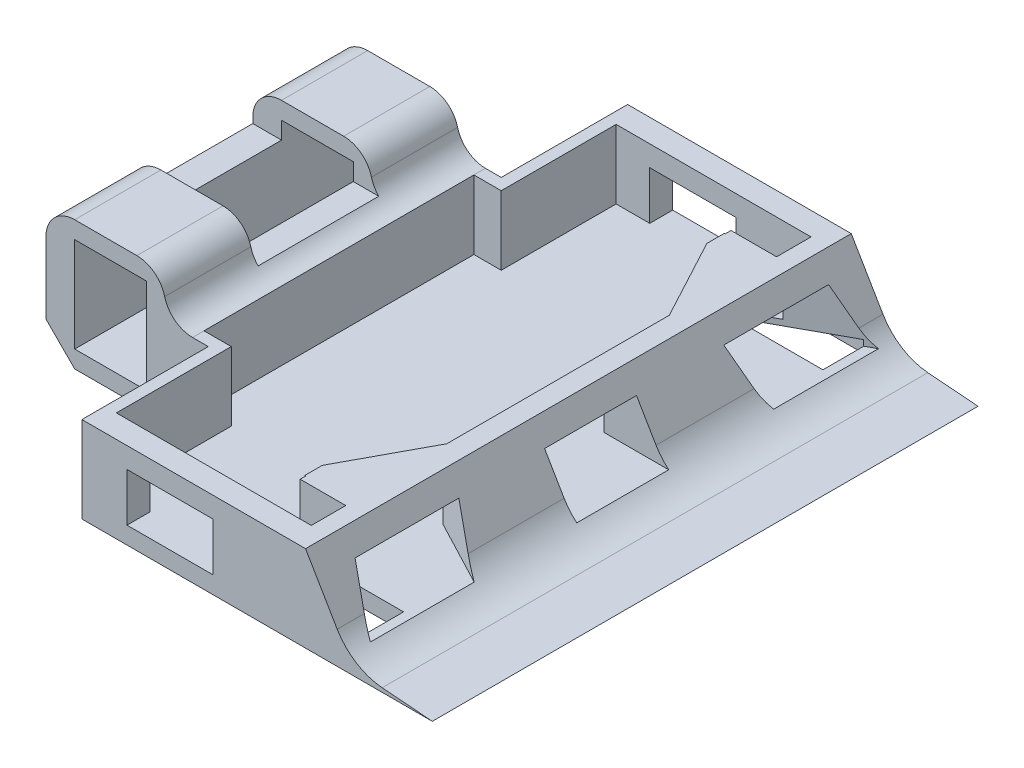
from build123d import *

# Parameters (mm, degrees)
SKETCH1_W                = 95
SKETCH1_H                = 95
BOSS_EXTRUDE1_DEPTH      = 20
SKETCH2_W                = 15
SKETCH2_H                = 8.4
CUT_EXTRUDE1_DEPTH       = 50
CUT_EXTRUDE3_DEPTH       = 100
FILLET1_R                = 10
CUT_EXTRUDE4_DEPTH       = 17
SKETCH8_W                = 15
SKETCH8_H                = 8.4
CUT_EXTRUDE5_DEPTH       = 4
SKETCH9_W                = 15
SKETCH9_H                = 8.4
CUT_EXTRUDE6_DEPTH       = 4
SKETCH10_W               = 15
SKETCH10_H               = 8.4
CUT_EXTRUDE7_DEPTH       = 100
SKETCH11_W               = 15
SKETCH11_H               = 8.4
CUT_EXTRUDE8_DEPTH       = 100
SKETCH12_W               = 96.22761595
SKETCH12_H               = 5
CUT_EXTRUDE9_DEPTH       = 100
SKETCH14_W               = 16
SKETCH14_H               = 8.4
CUT_EXTRUDE10_DEPTH      = 100
SKETCH15_W               = 16
SKETCH15_H               = 8.4
CUT_EXTRUDE11_DEPTH      = 100
SKETCH16_W               = 16
SKETCH16_H               = 8.4
CUT_EXTRUDE13_DEPTH      = 100
CUT_EXTRUDE16_DEPTH      = 12
SKETCH21_W               = 23.779532914
SKETCH21_H               = 2
BOSS_EXTRUDE2_DEPTH      = 12
SKETCH23_W               = 23.759878039
SKETCH23_H               = 2
BOSS_EXTRUDE3_DEPTH      = 12
CUT_EXTRUDE19_DEPTH      = 100
CUT_EXTRUDE19_DEPTH_BACK = 100
SKETCH24_W               = 15
SKETCH24_H               = 8.4
SKETCH26_W               = 20
SKETCH26_H               = 95
BOSS_EXTRUDE4_DEPTH      = 20
SKETCH31_W               = 95
SKETCH31_H               = 20
BOSS_EXTRUDE6_DEPTH      = 10
SKETCH32_W               = 12.5
SKETCH32_H               = 16.5
CUT_EXTRUDE22_DEPTH      = 100
SKETCH33_W               = 3.75
SKETCH33_H               = 20
CUT_EXTRUDE23_DEPTH      = 100
SKETCH34_W               = 26.25
SKETCH34_H               = 12.5
CUT_EXTRUDE24_DEPTH      = 100
SKETCH35_W               = 34
SKETCH35_H               = 47.07285681
CUT_EXTRUDE25_DEPTH      = 22
SKETCH36_W               = 34
SKETCH36_H               = 30.604426896
CUT_EXTRUDE26_DEPTH      = 22
SKETCH37_W               = 26.25
SKETCH37_H               = 21
CUT_EXTRUDE28_DEPTH      = 6
SKETCH38_W               = 5.75
SKETCH38_H               = 22.5
CUT_EXTRUDE29_DEPTH      = 100
CHAMFER1_SIZE            = 5
SKETCH39_W               = 2.070576792
SKETCH39_H               = 87
CUT_EXTRUDE30_DEPTH      = 12
FILLET4_R                = 5
FILLET5_R                = 5
SKETCH40_W               = 4.75
SKETCH40_H               = 47
CUT_EXTRUDE31_DEPTH      = 12
FILLET6_R                = 5
SKETCH46_W               = 17
SKETCH46_H               = 9
CUT_EXTRUDE36_DEPTH      = 4
SKETCH47_R               = 1.25
CUT_EXTRUDE37_DEPTH      = 100
SKETCH48_W               = 6
SKETCH48_H               = 6
CUT_EXTRUDE40_DEPTH      = 10
SKETCH49_W               = 2.104185464
SKETCH49_H               = 6
SKETCH49_W_2             = 2.084530589
CUT_EXTRUDE41_DEPTH      = 20
SKETCH50_W               = 3
SKETCH50_H               = 9
CUT_EXTRUDE42_DEPTH      = 20
SKETCH51_W               = 3
SKETCH51_H               = 15
BOSS_EXTRUDE7_DEPTH      = 2
SKETCH52_W               = 3
SKETCH52_H               = 15
BOSS_EXTRUDE8_DEPTH      = 2


with BuildPart() as part:
    # Sketch1 → Boss-Extrude1 (new body)
    with BuildSketch(Plane(origin=(0, 0, 0), x_dir=(1, 0, 0), z_dir=(0, 1, 0))):
        with Locations((-2.165031067, 2.677660124)):
            Rectangle(SKETCH1_W, SKETCH1_H)
    extrude(amount=BOSS_EXTRUDE1_DEPTH)

    # Sketch2 → Cut-Extrude1 (cut)
    with BuildSketch(Plane(origin=(45.334968933, 0, 0), x_dir=(0, 0, -1), z_dir=(1, 0, 0))):
        with Locations((2.677660124, 7.2)):
            Rectangle(SKETCH2_W, SKETCH2_H)
    extrude(amount=-CUT_EXTRUDE1_DEPTH, mode=Mode.SUBTRACT)

    # Sketch6 → Cut-Extrude3 (cut)
    with BuildSketch(Plane.XY.offset(44.822339876)):
        Polygon((45.334968933, 0), (31.416327077, 1.119733542), (20.334968933, 20), (45.334968933, 20), align=None)
    extrude(amount=-CUT_EXTRUDE3_DEPTH, mode=Mode.SUBTRACT)

    # Fillet1
    # the kernel refuses this fillet: 10 mm, written as the material it adds along each edge
    with BuildSketch(Plane(origin=(31.416327077, 1.119733542, 44.822339876), x_dir=(0.9967796443594351, -0.08018940447888392, 0), z_dir=(0, 0, -1))) as fillet1_piece_1_section:
        with BuildLine():
            CenterArc((FILLET1_R * 0.52046366993, -FILLET1_R), FILLET1_R, 90, 54.990678882)
            Line((-FILLET1_R * 0.298595051697, -FILLET1_R * 0.426290308146), (0, 0))
            Line((0, 0), (FILLET1_R * 0.52046366993, 0))
        make_face()
    fillet1_piece_1 = extrude(amount=95, mode=Mode.PRIVATE)
    fillet1_piece_1 = split(fillet1_piece_1, bisect_by=Plane(origin=(32.462514907, 1.548685907, 4.822339876), z_dir=(0, 0, 1)), keep=Keep.TOP, mode=Mode.PRIVATE)
    fillet1_piece_1 = split(fillet1_piece_1, bisect_by=Plane(origin=(32.462514907, 3, 24.822339876), z_dir=(0, -1, 0)), keep=Keep.TOP, mode=Mode.PRIVATE)
    add(fillet1_piece_1)
    with BuildSketch(Plane(origin=(31.416327077, 1.119733542, 44.822339876), x_dir=(0.9967796443594351, -0.08018940447888392, 0), z_dir=(0, 0, -1))) as fillet1_piece_2_section:
        with BuildLine():
            CenterArc((FILLET1_R * 0.52046366993, -FILLET1_R), FILLET1_R, 90, 54.990678882)
            Line((-FILLET1_R * 0.298595051697, -FILLET1_R * 0.426290308146), (0, 0))
            Line((0, 0), (FILLET1_R * 0.52046366993, 0))
        make_face()
    fillet1_piece_2 = extrude(amount=95, mode=Mode.PRIVATE)
    fillet1_piece_2 = split(fillet1_piece_2, bisect_by=Plane(origin=(29.780943428, 3.965739863, 4.822339876), z_dir=(0, 0, 1)), keep=Keep.TOP, mode=Mode.PRIVATE)
    fillet1_piece_2 = split(fillet1_piece_2, bisect_by=Plane(origin=(29.780943428, 3, 24.822339876), z_dir=(0, 1, 0)), keep=Keep.TOP, mode=Mode.PRIVATE)
    add(fillet1_piece_2)
    with BuildSketch(Plane(origin=(31.416327077, 1.119733542, 44.822339876), x_dir=(0.9967796443594351, -0.08018940447888392, 0), z_dir=(0, 0, -1))) as fillet1_piece_3_section:
        with BuildLine():
            CenterArc((FILLET1_R * 0.52046366993, -FILLET1_R), FILLET1_R, 90, 54.990678882)
            Line((-FILLET1_R * 0.298595051697, -FILLET1_R * 0.426290308146), (0, 0))
            Line((0, 0), (FILLET1_R * 0.52046366993, 0))
        make_face()
    fillet1_piece_3 = extrude(amount=95, mode=Mode.PRIVATE)
    fillet1_piece_3 = split(fillet1_piece_3, bisect_by=Plane(origin=(32.462514907, 1.548685907, -10.177660124), z_dir=(0, 0, 1)), keep=Keep.TOP, mode=Mode.PRIVATE)
    fillet1_piece_3 = split(fillet1_piece_3, bisect_by=Plane(origin=(32.462514907, 1.548685907, 4.822339876), z_dir=(0, 0, -1)), keep=Keep.TOP, mode=Mode.PRIVATE)
    fillet1_piece_3 = split(fillet1_piece_3, bisect_by=Plane(origin=(32.462514907, 3, -2.677660124), z_dir=(0, -1, 0)), keep=Keep.TOP, mode=Mode.PRIVATE)
    add(fillet1_piece_3)
    with BuildSketch(Plane(origin=(31.416327077, 1.119733542, 44.822339876), x_dir=(0.9967796443594351, -0.08018940447888392, 0), z_dir=(0, 0, -1))) as fillet1_piece_4_section:
        with BuildLine():
            CenterArc((FILLET1_R * 0.52046366993, -FILLET1_R), FILLET1_R, 90, 54.990678882)
            Line((-FILLET1_R * 0.298595051697, -FILLET1_R * 0.426290308146), (0, 0))
            Line((0, 0), (FILLET1_R * 0.52046366993, 0))
        make_face()
    fillet1_piece_4 = extrude(amount=95, mode=Mode.PRIVATE)
    fillet1_piece_4 = split(fillet1_piece_4, bisect_by=Plane(origin=(32.462514907, 1.548685907, -10.177660124), z_dir=(0, 0, -1)), keep=Keep.TOP, mode=Mode.PRIVATE)
    fillet1_piece_4 = split(fillet1_piece_4, bisect_by=Plane(origin=(32.462514907, 3, -30.177660124), z_dir=(0, -1, 0)), keep=Keep.TOP, mode=Mode.PRIVATE)
    add(fillet1_piece_4)
    with BuildSketch(Plane(origin=(31.416327077, 1.119733542, 44.822339876), x_dir=(0.9967796443594351, -0.08018940447888392, 0), z_dir=(0, 0, -1))) as fillet1_piece_5_section:
        with BuildLine():
            CenterArc((FILLET1_R * 0.52046366993, -FILLET1_R), FILLET1_R, 90, 54.990678882)
            Line((-FILLET1_R * 0.298595051697, -FILLET1_R * 0.426290308146), (0, 0))
            Line((0, 0), (FILLET1_R * 0.52046366993, 0))
        make_face()
    fillet1_piece_5 = extrude(amount=95, mode=Mode.PRIVATE)
    fillet1_piece_5 = split(fillet1_piece_5, bisect_by=Plane(origin=(29.780943428, 3.965739863, -10.177660124), z_dir=(0, 0, -1)), keep=Keep.TOP, mode=Mode.PRIVATE)
    fillet1_piece_5 = split(fillet1_piece_5, bisect_by=Plane(origin=(29.780943428, 3, -30.177660124), z_dir=(0, 1, 0)), keep=Keep.TOP, mode=Mode.PRIVATE)
    add(fillet1_piece_5)

    # Sketch7 → Cut-Extrude4 (cut)
    with BuildSketch(Plane(origin=(0, 20, 0), x_dir=(1, 0, 0), z_dir=(0, 1, 0))):
        Polygon((11.360713437, -29.822339876), (18.334968933, -16.542288661), (9.481601456, -11.892784997), (2.50734596, -25.172836212), align=None)
        Polygon((18.334968933, 22.020257336), (11.132000664, 35.177660124), (2.360398805, 30.375681278), (9.563367074, 17.21827849), align=None)
    extrude(amount=-CUT_EXTRUDE4_DEPTH, mode=Mode.SUBTRACT)

    # Sketch8 → Cut-Extrude5 (cut)
    with BuildSketch(Plane(origin=(12.327397833, 0, 6.473952599), x_dir=(0.4649503663833249, 0, -0.885336747684186), z_dir=(0.8853367476841859, 0, 0.4649503663833248))):
        with Locations((-13.620645519, 7.2)):
            Rectangle(SKETCH8_W, SKETCH8_H)
    extrude(amount=-CUT_EXTRUDE5_DEPTH, mode=Mode.SUBTRACT)

    # Sketch9 → Cut-Extrude6 (cut)
    with BuildSketch(Plane(origin=(14.610669282, 0, -7.99855328), x_dir=(-0.48019788460400603, 0, -0.8771601858394155), z_dir=(0.8771601858394155, 0, -0.48019788460400603))):
        with Locations((18.010879722, 7.2)):
            Rectangle(SKETCH9_W, SKETCH9_H)
    extrude(amount=-CUT_EXTRUDE6_DEPTH, mode=Mode.SUBTRACT)

    # Sketch10 → Cut-Extrude7 (cut)
    with BuildSketch(Plane(origin=(8.786050842, 0, 4.614151134), x_dir=(0.464950366383325, 0, -0.8853367476841859), z_dir=(0.8853367476841859, 0, 0.464950366383325))):
        with Locations((-13.620645519, 7.2)):
            Rectangle(SKETCH10_W, SKETCH10_H)
    extrude(amount=CUT_EXTRUDE7_DEPTH, mode=Mode.SUBTRACT)

    # Sketch11 → Cut-Extrude8 (cut)
    with BuildSketch(Plane(origin=(11.102028539, 0, -6.077761742), x_dir=(-0.48019788460400603, 0, -0.8771601858394155), z_dir=(0.8771601858394155, 0, -0.48019788460400603))):
        with Locations((18.010879722, 7.2)):
            Rectangle(SKETCH11_W, SKETCH11_H)
    extrude(amount=CUT_EXTRUDE8_DEPTH, mode=Mode.SUBTRACT)

    # Sketch12 → Cut-Extrude9 (cut)
    with BuildSketch(Plane.XY.offset(44.822339876)):
        with Locations((-1.551223092, 17.5)):
            Rectangle(SKETCH12_W, SKETCH12_H)
    extrude(amount=-CUT_EXTRUDE9_DEPTH, mode=Mode.SUBTRACT)

    # Sketch14 → Cut-Extrude10 (cut)
    with BuildSketch(Plane(origin=(11.102028539, 0, -6.077761742), x_dir=(-0.48019788460400603, 0, -0.8771601858394155), z_dir=(0.8771601858394155, 0, -0.48019788460400603))):
        with Locations((18.510879722, 7.2)):
            Rectangle(SKETCH14_W, SKETCH14_H)
    extrude(amount=CUT_EXTRUDE10_DEPTH, mode=Mode.SUBTRACT)

    # Sketch15 → Cut-Extrude11 (cut)
    with BuildSketch(Plane(origin=(8.786050842, 0, 4.614151134), x_dir=(0.464950366383325, 0, -0.8853367476841859), z_dir=(0.8853367476841859, 0, 0.464950366383325))):
        with Locations((-14.120645519, 7.2)):
            Rectangle(SKETCH15_W, SKETCH15_H)
    extrude(amount=CUT_EXTRUDE11_DEPTH, mode=Mode.SUBTRACT)

    # Sketch16 → Cut-Extrude13 (cut)
    with BuildSketch(Plane(origin=(-4.665031067, 0, 0), x_dir=(0, 0, -1), z_dir=(1, 0, 0))):
        with Locations((2.677660124, 7.2)):
            Rectangle(SKETCH16_W, SKETCH16_H)
    extrude(amount=CUT_EXTRUDE13_DEPTH, mode=Mode.SUBTRACT)

    # Sketch19 → Cut-Extrude16 (cut)
    with BuildSketch(Plane(origin=(0, 15, 0), x_dir=(1, 0, 0), z_dir=(0, 1, 0))):
        Polygon((12.165423764, -30.809704699), (19.747212292, -16.720116958), (19.744163962, 22.025988312), (12.185078639, 36.127769372), (12.185078639, 48.177660124), (-11.594454275, 48.177660124), (-11.594454275, -42.822339876), (12.165423764, -42.822339876), align=None)
    extrude(amount=-CUT_EXTRUDE16_DEPTH, mode=Mode.SUBTRACT)

    # Sketch21 → Boss-Extrude2 (add)
    with BuildSketch(Plane(origin=(0, 3, 0), x_dir=(1, 0, 0), z_dir=(0, 1, 0))):
        with Locations((0.295312182, 47.177660124)):
            Rectangle(SKETCH21_W, SKETCH21_H)
    extrude(amount=BOSS_EXTRUDE2_DEPTH)

    # Sketch23 → Boss-Extrude3 (add)
    with BuildSketch(Plane(origin=(0, 3, 0), x_dir=(1, 0, 0), z_dir=(0, 1, 0))):
        with Locations((0.285484745, -41.822339876)):
            Rectangle(SKETCH23_W, SKETCH23_H)
    extrude(amount=BOSS_EXTRUDE3_DEPTH)

    # Sketch24 → Cut-Extrude19 (cut, two sides: drawn at the far end of the back side and taken through both)
    with BuildSketch(Plane.XY.offset(-46.177660124).offset(-CUT_EXTRUDE19_DEPTH_BACK)):
        with Locations((-0.314454275, 7.2)):
            Rectangle(SKETCH24_W, SKETCH24_H)
    extrude(amount=CUT_EXTRUDE19_DEPTH + CUT_EXTRUDE19_DEPTH_BACK, mode=Mode.SUBTRACT)

    # Sketch26 → Boss-Extrude4 (add)
    with BuildSketch(Plane(origin=(0, 15, 0), x_dir=(1, 0, 0), z_dir=(0, 1, 0))):
        with Locations((-39.665031067, 2.677660124)):
            Rectangle(SKETCH26_W, SKETCH26_H)
    extrude(amount=BOSS_EXTRUDE4_DEPTH)

    # Sketch31 → Boss-Extrude6 (add)
    with BuildSketch(Plane(origin=(-29.665031067, 0, 0), x_dir=(0, 0, -1), z_dir=(1, 0, 0))):
        with Locations((2.677660124, 25)):
            Rectangle(SKETCH31_W, SKETCH31_H)
    extrude(amount=BOSS_EXTRUDE6_DEPTH)

    # Sketch32 → Cut-Extrude22 (cut)
    with BuildSketch(Plane(origin=(0, 0, -50.177660124), x_dir=(-1, 0, 0), z_dir=(0, 0, -1))):
        with Locations((32.665031067, 11.25)):
            Rectangle(SKETCH32_W, SKETCH32_H)
    extrude(amount=-CUT_EXTRUDE22_DEPTH, mode=Mode.SUBTRACT)

    # Sketch33 → Cut-Extrude23 (cut)
    with BuildSketch(Plane(origin=(0, 0, -50.177660124), x_dir=(-1, 0, 0), z_dir=(0, 0, -1))):
        with Locations((21.540031067, 25)):
            Rectangle(SKETCH33_W, SKETCH33_H)
    extrude(amount=-CUT_EXTRUDE23_DEPTH, mode=Mode.SUBTRACT)

    # Sketch34 → Cut-Extrude24 (cut)
    with BuildSketch(Plane(origin=(0, 0, -50.177660124), x_dir=(-1, 0, 0), z_dir=(0, 0, -1))):
        with Locations((36.540031067, 28.75)):
            Rectangle(SKETCH34_W, SKETCH34_H)
    extrude(amount=-CUT_EXTRUDE24_DEPTH, mode=Mode.SUBTRACT)

    # Sketch35 → Cut-Extrude25 (cut)
    with BuildSketch(Plane(origin=(0, 0, -50.177660124), x_dir=(-1, 0, 0), z_dir=(0, 0, -1))):
        with Locations((32.665031067, 23.536428405)):
            Rectangle(SKETCH35_W, SKETCH35_H)
    extrude(amount=-CUT_EXTRUDE25_DEPTH, mode=Mode.SUBTRACT)

    # Sketch36 → Cut-Extrude26 (cut)
    with BuildSketch(Plane.XY.offset(44.822339876)):
        with Locations((-32.665031067, 15.302213448)):
            Rectangle(SKETCH36_W, SKETCH36_H)
    extrude(amount=-CUT_EXTRUDE26_DEPTH, mode=Mode.SUBTRACT)

    # Sketch37 → Cut-Extrude28 (cut)
    with BuildSketch(Plane(origin=(0, 22.5, 0), x_dir=(1, 0, 0), z_dir=(0, 1, 0))):
        with Locations((-36.540031067, 2.677660124)):
            Rectangle(SKETCH37_W, SKETCH37_H)
    extrude(amount=-CUT_EXTRUDE28_DEPTH, mode=Mode.SUBTRACT)

    # Sketch38 → Cut-Extrude29 (cut)
    with BuildSketch(Plane.XY.offset(22.822339876)):
        with Locations((-46.790031067, 11.25)):
            Rectangle(SKETCH38_W, SKETCH38_H)
    extrude(amount=-CUT_EXTRUDE29_DEPTH, mode=Mode.SUBTRACT)

    # Chamfer1
    chamfer1_edges = [part.edges().sort_by_distance(p)[0] for p in [
        (-43.915031067, 0, -2.677660124),
    ]]
    chamfer(chamfer1_edges, length=CHAMFER1_SIZE)

    # Sketch39 → Cut-Extrude30 (cut)
    with BuildSketch(Plane(origin=(0, 15, 0), x_dir=(1, 0, 0), z_dir=(0, 1, 0))):
        with Locations((-12.629742671, 2.677660124)):
            Rectangle(SKETCH39_W, SKETCH39_H)
    extrude(amount=-CUT_EXTRUDE30_DEPTH, mode=Mode.SUBTRACT)

    # Fillet4
    # the kernel refuses this fillet: 5 mm, written as the material it adds along each edge
    with BuildSketch(Plane(origin=(-23.415031067, 15, -28.177660124), x_dir=(1, 0, 0), z_dir=(0, 0, 1))) as fillet4_piece_1_section:
        with BuildLine():
            CenterArc((FILLET4_R, FILLET4_R), FILLET4_R, 180, 90)
            Line((0, FILLET4_R), (0, 0))
            Line((0, 0), (FILLET4_R, 0))
        make_face()
    fillet4_piece_1 = extrude(amount=51, mode=Mode.PRIVATE)
    fillet4_piece_1 = split(fillet4_piece_1, bisect_by=Plane(origin=(-21.940460429, 15.541584114, -13.177660124), z_dir=(0, 0, -1)), keep=Keep.TOP, mode=Mode.PRIVATE)
    fillet4_piece_1 = split(fillet4_piece_1, bisect_by=Plane(origin=(-21.940460429, 16.5, -20.677660124), z_dir=(0, -1, 0)), keep=Keep.TOP, mode=Mode.PRIVATE)
    add(fillet4_piece_1)
    with BuildSketch(Plane(origin=(-23.415031067, 15, -28.177660124), x_dir=(1, 0, 0), z_dir=(0, 0, 1))) as fillet4_piece_2_section:
        with BuildLine():
            CenterArc((FILLET4_R, FILLET4_R), FILLET4_R, 180, 90)
            Line((0, FILLET4_R), (0, 0))
            Line((0, 0), (FILLET4_R, 0))
        make_face()
    fillet4_piece_2 = extrude(amount=51, mode=Mode.PRIVATE)
    fillet4_piece_2 = split(fillet4_piece_2, bisect_by=Plane(origin=(-23.084676974, 17.513403735, -13.177660124), z_dir=(0, 0, -1)), keep=Keep.TOP, mode=Mode.PRIVATE)
    fillet4_piece_2 = split(fillet4_piece_2, bisect_by=Plane(origin=(-23.084676974, 16.5, -20.677660124), z_dir=(0, 1, 0)), keep=Keep.TOP, mode=Mode.PRIVATE)
    add(fillet4_piece_2)
    with BuildSketch(Plane(origin=(-23.415031067, 15, -28.177660124), x_dir=(1, 0, 0), z_dir=(0, 0, 1))) as fillet4_piece_3_section:
        with BuildLine():
            CenterArc((FILLET4_R, FILLET4_R), FILLET4_R, 180, 90)
            Line((0, FILLET4_R), (0, 0))
            Line((0, 0), (FILLET4_R, 0))
        make_face()
    fillet4_piece_3 = extrude(amount=51, mode=Mode.PRIVATE)
    fillet4_piece_3 = split(fillet4_piece_3, bisect_by=Plane(origin=(-21.940460429, 15.541584114, -13.177660124), z_dir=(0, 0, 1)), keep=Keep.TOP, mode=Mode.PRIVATE)
    fillet4_piece_3 = split(fillet4_piece_3, bisect_by=Plane(origin=(-21.940460429, 16.5, -2.677660124), z_dir=(0, -1, 0)), keep=Keep.TOP, mode=Mode.PRIVATE)
    fillet4_piece_3 = split(fillet4_piece_3, bisect_by=Plane(origin=(-21.940460429, 15.541584114, 7.822339876), z_dir=(0, 0, -1)), keep=Keep.TOP, mode=Mode.PRIVATE)
    add(fillet4_piece_3)
    with BuildSketch(Plane(origin=(-23.415031067, 15, -28.177660124), x_dir=(1, 0, 0), z_dir=(0, 0, 1))) as fillet4_piece_4_section:
        with BuildLine():
            CenterArc((FILLET4_R, FILLET4_R), FILLET4_R, 180, 90)
            Line((0, FILLET4_R), (0, 0))
            Line((0, 0), (FILLET4_R, 0))
        make_face()
    fillet4_piece_4 = extrude(amount=51, mode=Mode.PRIVATE)
    fillet4_piece_4 = split(fillet4_piece_4, bisect_by=Plane(origin=(-21.940460429, 16.5, 15.322339876), z_dir=(0, -1, 0)), keep=Keep.TOP, mode=Mode.PRIVATE)
    fillet4_piece_4 = split(fillet4_piece_4, bisect_by=Plane(origin=(-21.940460429, 15.541584114, 7.822339876), z_dir=(0, 0, 1)), keep=Keep.TOP, mode=Mode.PRIVATE)
    add(fillet4_piece_4)
    with BuildSketch(Plane(origin=(-23.415031067, 15, -28.177660124), x_dir=(1, 0, 0), z_dir=(0, 0, 1))) as fillet4_piece_5_section:
        with BuildLine():
            CenterArc((FILLET4_R, FILLET4_R), FILLET4_R, 180, 90)
            Line((0, FILLET4_R), (0, 0))
            Line((0, 0), (FILLET4_R, 0))
        make_face()
    fillet4_piece_5 = extrude(amount=51, mode=Mode.PRIVATE)
    fillet4_piece_5 = split(fillet4_piece_5, bisect_by=Plane(origin=(-23.084676974, 16.5, 15.322339876), z_dir=(0, 1, 0)), keep=Keep.TOP, mode=Mode.PRIVATE)
    fillet4_piece_5 = split(fillet4_piece_5, bisect_by=Plane(origin=(-23.084676974, 17.513403735, 7.822339876), z_dir=(0, 0, 1)), keep=Keep.TOP, mode=Mode.PRIVATE)
    add(fillet4_piece_5)

    # Fillet5
    fillet5_edges = [part.edges().sort_by_distance(p)[0] for p in [
        (-23.415031067, 22.5, 15.322339876),
        (-23.415031067, 22.5, -20.677660124),
    ]]
    fillet(fillet5_edges, radius=FILLET5_R)

    # Sketch40 → Cut-Extrude31 (cut)
    with BuildSketch(Plane(origin=(0, 15, 0), x_dir=(1, 0, 0), z_dir=(0, 1, 0))):
        with Locations((-16.040031067, 2.677660124)):
            Rectangle(SKETCH40_W, SKETCH40_H)
    extrude(amount=-CUT_EXTRUDE31_DEPTH, mode=Mode.SUBTRACT)

    # Fillet6
    fillet6_edges = [part.edges().sort_by_distance(p)[0] for p in [
        (-43.915031067, 22.5, -20.677660124),
        (-43.915031067, 22.5, 15.322339876),
    ]]
    fillet(fillet6_edges, radius=FILLET6_R)

    # Sketch46 → Cut-Extrude36 (cut)
    with BuildSketch(Plane(origin=(0, 0, 0), x_dir=(-1, 0, 0), z_dir=(0, -1, 0))):
        with Locations((-20.834968933, -38.322339876)):
            Rectangle(SKETCH46_W, SKETCH46_H)
        with Locations((-20.834968933, 43.677660124)):
            Rectangle(SKETCH46_W, SKETCH46_H)
    extrude(amount=-CUT_EXTRUDE36_DEPTH, mode=Mode.SUBTRACT)

    # Sketch47 → Cut-Extrude37 (cut)
    with BuildSketch(Plane(origin=(0, 4, 0), x_dir=(-1, 0, 0), z_dir=(0, -1, 0))):
        with Locations(Location((-17.334968933, -38.322339876, 0), (0, 0, 90))):
            Circle(SKETCH47_R)
        with Locations(Location((-17.334968933, 43.677660124, 0), (0, 0, 90))):
            Circle(SKETCH47_R)
    extrude(amount=-CUT_EXTRUDE37_DEPTH, mode=Mode.SUBTRACT)

    # Sketch48 → Cut-Extrude40 (cut)
    with BuildSketch(Plane(origin=(0, 15, 0), x_dir=(1, 0, 0), z_dir=(0, 1, 0))):
        with Locations((17.269609228, -37.822339876)):
            Rectangle(SKETCH48_W, SKETCH48_H)
        with Locations((17.269609228, 43.177660124)):
            Rectangle(SKETCH48_W, SKETCH48_H)
    extrude(amount=-CUT_EXTRUDE40_DEPTH, mode=Mode.SUBTRACT)

    # Sketch49 → Cut-Extrude41 (cut)
    with BuildSketch(Plane(origin=(0, 15, 0), x_dir=(1, 0, 0), z_dir=(0, 1, 0))):
        with Locations((13.217516496, -37.822339876)):
            Rectangle(SKETCH49_W, SKETCH49_H)
        with Locations((13.227343934, 43.177660124)):
            Rectangle(SKETCH49_W_2, SKETCH49_H)
    extrude(amount=-CUT_EXTRUDE41_DEPTH, mode=Mode.SUBTRACT)

    # Sketch50 → Cut-Extrude42 (cut)
    with BuildSketch(Plane(origin=(0, 0, 0), x_dir=(-1, 0, 0), z_dir=(0, -1, 0))):
        with Locations((-10.834968933, -38.322339876)):
            Rectangle(SKETCH50_W, SKETCH50_H)
        with Locations((-10.834968933, 43.677660124)):
            Rectangle(SKETCH50_W, SKETCH50_H)
    extrude(amount=-CUT_EXTRUDE42_DEPTH, mode=Mode.SUBTRACT)

    # Sketch51 → Boss-Extrude7 (add)
    with BuildSketch(Plane(origin=(0, 0, 42.822339876), x_dir=(-1, 0, 0), z_dir=(0, 0, -1))):
        with Locations((-10.834968933, 7.5)):
            Rectangle(SKETCH51_W, SKETCH51_H)
    extrude(amount=BOSS_EXTRUDE7_DEPTH)

    # Sketch52 → Boss-Extrude8 (add)
    with BuildSketch(Plane.XY.offset(-48.177660124)):
        with Locations((10.834968933, 7.5)):
            Rectangle(SKETCH52_W, SKETCH52_H)
    extrude(amount=BOSS_EXTRUDE8_DEPTH)


solid = part.part
